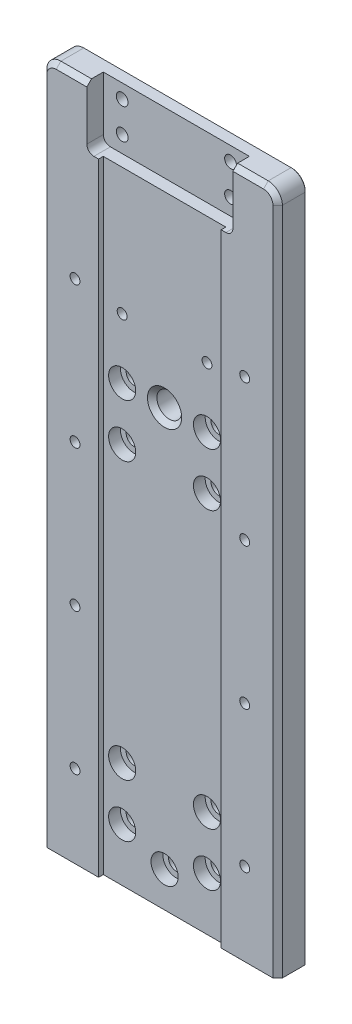
from build123d import *

# Parameters (mm, degrees)
SKETCH1_W               = 100
SKETCH1_H               = 290
BOSS_EXTRUDE1_DEPTH     = 6
SKETCH2_W               = 62
SKETCH2_H               = 26
CUT_EXTRUDE1_DEPTH      = 7
SKETCH3_W               = 52
SKETCH3_H               = 290
CUT_EXTRUDE2_DEPTH      = 2
SKETCH4_R               = 2.5
SKETCH4_R_2             = 5.25
SKETCH4_R_3             = 2.1
SKETCH4_R_4             = 3.3
CUT_EXTRUDE_HOLES_DEPTH = 21
FILLET1_R               = 3
FILLET2_R               = 6
CHAMFER1_SIZE           = 2
SKETCH5_R               = 5.75
CUT_EXTRUDE5_DEPTH      = 5
CHAMFER2_SIZE           = 2
CHAMFER3_SIZE           = 0.3


with BuildPart() as part:
    # Sketch1 → Boss-Extrude1 (new, symmetric)
    with BuildSketch(Plane.XY):
        Rectangle(SKETCH1_W, SKETCH1_H)
    extrude(amount=BOSS_EXTRUDE1_DEPTH, both=True)

    # Sketch2 → Cut-Extrude1 (cut)
    with BuildSketch(Plane.XY.offset(6)):
        with Locations((0, 132)):
            Rectangle(SKETCH2_W, SKETCH2_H)
    extrude(amount=-CUT_EXTRUDE1_DEPTH, mode=Mode.SUBTRACT)

    # Sketch3 → Cut-Extrude2 (cut)
    with BuildSketch(Plane.XY.offset(6)):
        Rectangle(SKETCH3_W, SKETCH3_H)
    extrude(amount=-CUT_EXTRUDE2_DEPTH, mode=Mode.SUBTRACT)

    # Sketch4 → Cut-Extrude HOLES (cut)
    with BuildSketch(Plane.XY.offset(-6)):
        with Locations((-23, 139)):
            Circle(SKETCH4_R)
        with Locations((23, 139)):
            Circle(SKETCH4_R)
        with Locations((23, 126)):
            Circle(SKETCH4_R)
        with Locations((-23, 126)):
            Circle(SKETCH4_R)
        with Locations((0, 39.64)):
            Circle(SKETCH4_R_2)
        with Locations((-18, 65.14)):
            Circle(SKETCH4_R_3)
        with Locations((-18, 39.64)):
            Circle(SKETCH4_R_4)
        with Locations((-18, 17.14)):
            Circle(SKETCH4_R_4)
        with Locations((-36, 70)):
            Circle(SKETCH4_R_3)
        with Locations((-36, 10)):
            Circle(SKETCH4_R_3)
        with Locations((-36, -110)):
            Circle(SKETCH4_R_3)
        with Locations((-36, -50)):
            Circle(SKETCH4_R_3)
        with Locations((-18, -100)):
            Circle(SKETCH4_R_4)
        with Locations((-18, -122.5)):
            Circle(SKETCH4_R_4)
        with Locations((18, -100)):
            Circle(SKETCH4_R_4)
        with Locations((18, -122.5)):
            Circle(SKETCH4_R_4)
        with Locations((0, -130)):
            Circle(SKETCH4_R_4)
        with Locations((36, 70)):
            Circle(SKETCH4_R_3)
        with Locations((18, 65.14)):
            Circle(SKETCH4_R_3)
        with Locations((18, 17.14)):
            Circle(SKETCH4_R_4)
        with Locations((18, 39.64)):
            Circle(SKETCH4_R_4)
        with Locations((36, 10)):
            Circle(SKETCH4_R_3)
        with Locations((36, -50)):
            Circle(SKETCH4_R_3)
        with Locations((36, -110)):
            Circle(SKETCH4_R_3)
    extrude(amount=CUT_EXTRUDE_HOLES_DEPTH, mode=Mode.SUBTRACT)

    # Fillet1
    fillet1_edges = [part.edges().sort_by_distance(p)[0] for p in [
        (31, 119, 2.5),
        (-31, 119, 2.5),
    ]]
    fillet(fillet1_edges, radius=FILLET1_R)

    # Fillet2
    fillet2_edges = [part.edges().sort_by_distance(p)[0] for p in [
        (50, 145, 0),
        (-50, 145, 0),
    ]]
    fillet(fillet2_edges, radius=FILLET2_R)

    # Chamfer1
    chamfer1_edges = [part.edges().sort_by_distance(p)[0] for p in [
        (50, -3, 6),
        (48.242640687, 143.242640687, 6),
        (37.5, 145, 6),
        (-50, -3, 6),
        (-48.242640687, 143.242640687, 6),
        (-37.5, 145, 6),
    ]]
    chamfer(chamfer1_edges, length=CHAMFER1_SIZE)

    # Sketch5 → Cut-Extrude5 (cut)
    with BuildSketch(Plane.XY.offset(4)):
        with Locations((-18, 39.64)):
            Circle(SKETCH5_R)
        with Locations((-18, 17.14)):
            Circle(SKETCH5_R)
        with Locations((18, 17.14)):
            Circle(SKETCH5_R)
        with Locations((18, 39.64)):
            Circle(SKETCH5_R)
        with Locations((18, -100)):
            Circle(SKETCH5_R)
        with Locations((-18, -100)):
            Circle(SKETCH5_R)
        with Locations((-18, -122.5)):
            Circle(SKETCH5_R)
        with Locations((0, -130)):
            Circle(SKETCH5_R)
        with Locations((18, -122.5)):
            Circle(SKETCH5_R)
    extrude(amount=-CUT_EXTRUDE5_DEPTH, mode=Mode.SUBTRACT)

    # Chamfer2
    chamfer2_edges = [part.edges().sort_by_distance(p)[0] for p in [
        (-5.25, 39.64, 4),
    ]]
    chamfer(chamfer2_edges, length=CHAMFER2_SIZE)

    # Chamfer3
    chamfer3_edges = [part.edges().sort_by_distance(p)[0] for p in [
        (-50, -3, -6),
        (-48.242640687, 143.242640687, -6),
        (48.242640687, 143.242640687, -6),
        (50, -3, -6),
        (0, 145, -6),
    ]]
    chamfer(chamfer3_edges, length=CHAMFER3_SIZE)


solid = part.part
